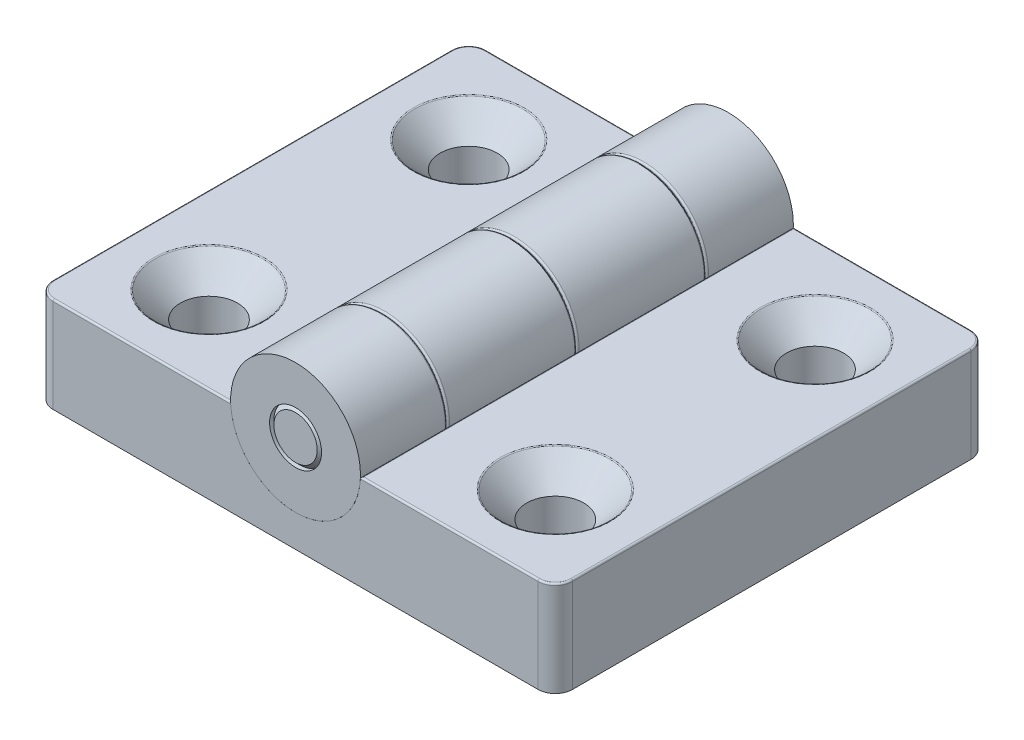
from build123d import *

# Parameters (mm, degrees)
SKETCH_1_R                  = 7.5
SKETCH_1_R_2                = 3
EXTRUDE_1_DEPTH             = 25
SKETCH_2_R                  = 3
EXTRUDE_2_DEPTH             = 25
CHAMFER_1_SIZE              = 0.5
SKETCH_3_W                  = 2
SKETCH_3_H                  = 0.1
SKETCH_3_W_2                = 2.605320606
FILLET_1_R                  = 0.2
EXTRUDE_6_DEPTH             = 50
HOLE_WIZARD_M6_1_AT_2_COUNT = 2
HOLE_WIZARD_M6_1_AT_2_PITCH = 40
HOLE_WIZARD_M6_1_AT_3_COUNT = 2
HOLE_WIZARD_M6_1_AT_3_PITCH = 30
HOLE_WIZARD_M6_1_AT_4_COUNT = 2
HOLE_WIZARD_M6_1_AT_4_PITCH = 50
FILLET_2_R                  = 0.2
FILLET_3_R                  = 2
CHAMFER_2_SIZE              = 0.5


with BuildPart() as part:
    # 草图1 → 凸台-拉伸1 (new, symmetric)
    with BuildSketch(Plane.XY):
        Circle(SKETCH_1_R)
        Circle(SKETCH_1_R_2, mode=Mode.SUBTRACT)
    extrude(amount=EXTRUDE_1_DEPTH, both=True)

    # 草图3 → 切除-旋转1 (revolve, cut)
    with BuildSketch(Plane(origin=(0, 0, 0), x_dir=(1, 0, 0), z_dir=(0, 1, 0))):
        with Locations((6.5, 14.95)):
            Rectangle(SKETCH_3_W, SKETCH_3_H)
        with Locations((6.5, 0)):
            Rectangle(SKETCH_3_W, SKETCH_3_H)
        with Locations((6.197339697, -14.95)):
            Rectangle(SKETCH_3_W_2, SKETCH_3_H)
    revolve(axis=Axis((0, 0, 25), (0, 0, -1)), mode=Mode.SUBTRACT)

    # 圆角1
    fillet_1_edges = [part.edges().sort_by_distance(p)[0] for p in [
        (-7.5, 0, -15),
        (-7.5, 0, -14.9),
        (-7.5, 0, -0.05),
        (-7.5, 0, 0.05),
        (-7.5, 0, 14.9),
        (-7.5, 0, 15),
    ]]
    fillet(fillet_1_edges, radius=FILLET_1_R)


with BuildPart() as body_2:
    # 草图2 → 凸台-拉伸2 (new, symmetric)
    with BuildSketch(Plane.XY):
        Circle(SKETCH_2_R)
    extrude(amount=EXTRUDE_2_DEPTH, both=True)

    # 倒角1
    chamfer_1_edges = [body_2.edges().sort_by_distance(p)[0] for p in [
        (-3, 0, 25),
    ]]
    chamfer(chamfer_1_edges, length=CHAMFER_1_SIZE)

    # 倒角2
    chamfer_2_edges = [body_2.edges().sort_by_distance(p)[0] for p in [
        (-3, 0, -25),
    ]]
    chamfer(chamfer_2_edges, length=CHAMFER_2_SIZE)


with BuildPart() as body_3:
    # 草图5 → 凸台-拉伸6 (new body)
    with BuildSketch(Plane(origin=(0, 0, -25), x_dir=(-1, 0, 0), z_dir=(0, 0, -1))):
        with BuildLine():
            Line((7.497332859, -0.2), (30, -0.2))
            Line((30, -0.2), (30, -11.2))
            Line((30, -11.2), (-30, -11.2))
            Line((-30, -11.2), (-30, -0.2))
            Line((-30, -0.2), (-7.497332859, -0.2))
            ThreePointArc((-7.497332859, -0.2), (0, -7.5), (7.497332859, -0.2))
        make_face()
    extrude(amount=-EXTRUDE_6_DEPTH)

    # 草图6 → M6 平头机械螺钉的锥形沉头孔1 (revolve, cut)
    with BuildSketch(Plane(origin=(-20, -0.2, -15), x_dir=(0, 0, 1), z_dir=(1, 0, 0))):
        Polygon((0, 0), (0, 11), (3.3, 11), (3.3, 3), (6.3, 0), align=None)
    hole_wizard_m6_1 = revolve(axis=Axis((-20, 6.15, -15), (0, -1, 0)), mode=Mode.SUBTRACT)

    # M6 平头机械螺钉的锥形沉头孔1 at 2: M6 平头机械螺钉的锥形沉头孔1 ×2
    with Locations(*[(i * HOLE_WIZARD_M6_1_AT_2_PITCH, 0, 0) for i in range(1, HOLE_WIZARD_M6_1_AT_2_COUNT)]):
        add(hole_wizard_m6_1, mode=Mode.SUBTRACT)

    # M6 平头机械螺钉的锥形沉头孔1 at 3: M6 平头机械螺钉的锥形沉头孔1 ×2
    with Locations(*[(0, 0, i * HOLE_WIZARD_M6_1_AT_3_PITCH) for i in range(1, HOLE_WIZARD_M6_1_AT_3_COUNT)]):
        add(hole_wizard_m6_1, mode=Mode.SUBTRACT)

    # M6 平头机械螺钉的锥形沉头孔1 at 4: M6 平头机械螺钉的锥形沉头孔1 ×2
    with Locations(*[Vector(0.8, 0, 0.6) * (i * HOLE_WIZARD_M6_1_AT_4_PITCH) for i in range(1, HOLE_WIZARD_M6_1_AT_4_COUNT)]):
        add(hole_wizard_m6_1, mode=Mode.SUBTRACT)

    # 圆角2
    fillet_2_edges = [body_3.edges().sort_by_distance(p)[0] for p in [
        (-18.74866643, -0.2, -25),
        (20, -0.2, 8.7),
        (18.74866643, -0.2, -25),
        (-20, -0.2, 8.7),
        (-30, -0.2, 0),
        (-18.74866643, -0.2, 25),
        (20, -0.2, -21.3),
        (-7.497332859, -0.2, 0),
        (7.497332859, -0.2, 0),
        (18.74866643, -0.2, 25),
        (30, -0.2, 0),
        (-20, -0.2, -21.3),
    ]]
    fillet(fillet_2_edges, radius=FILLET_2_R)

    # 圆角3
    # the kernel refuses this fillet: 2 mm, written as the material it takes off along each edge
    with BuildSketch(Plane(origin=(28, -0.2, 23), x_dir=(0, 0, 1), z_dir=(-1, 0, 0))) as fillet_3_piece_1:
        with BuildLine():
            CenterArc((1.8, -0.2), 0.2, 0, 90)
            Line((2, -0.2), (2, 0))
            Line((2, 0), (1.8, 0))
        make_face()
    revolve(axis=Axis((28, -0.2, 23), (0, 1, 0)), revolution_arc=90, mode=Mode.SUBTRACT)
    with BuildSketch(Plane(origin=(28, -0.2, -23), x_dir=(1, 0, 0), z_dir=(0, 0, 1))) as fillet_3_piece_2:
        with BuildLine():
            CenterArc((1.8, -0.2), 0.2, 0, 90)
            Line((2, -0.2), (2, 0))
            Line((2, 0), (1.8, 0))
        make_face()
    revolve(axis=Axis((28, -0.2, -23), (0, 1, 0)), revolution_arc=90, mode=Mode.SUBTRACT)
    with BuildSketch(Plane(origin=(-28, -0.2, 23), x_dir=(-1, 0, 0), z_dir=(0, 0, -1))) as fillet_3_piece_3:
        with BuildLine():
            CenterArc((1.8, -0.2), 0.2, 0, 90)
            Line((2, -0.2), (2, 0))
            Line((2, 0), (1.8, 0))
        make_face()
    revolve(axis=Axis((-28, -0.2, 23), (0, 1, 0)), revolution_arc=90, mode=Mode.SUBTRACT)
    with BuildSketch(Plane(origin=(-28, -0.2, -23), x_dir=(0, 0, -1), z_dir=(1, 0, 0))) as fillet_3_piece_4:
        with BuildLine():
            CenterArc((1.8, -0.2), 0.2, 0, 90)
            Line((2, -0.2), (2, 0))
            Line((2, 0), (1.8, 0))
        make_face()
    revolve(axis=Axis((-28, -0.2, -23), (0, 1, 0)), revolution_arc=90, mode=Mode.SUBTRACT)
    with BuildSketch(Plane(origin=(-30, -0.2, -25), x_dir=(1, 0, 0), z_dir=(0, -1, 0)), Plane(origin=(-30, -0.2, 25), x_dir=(0, 0, -1), z_dir=(0, -1, 0)), Plane(origin=(30, -16.2, -25), x_dir=(-1, 0, 0), z_dir=(0, 1, 0))) as fillet_3_piece_5:
        with BuildLine():
            CenterArc((FILLET_3_R, FILLET_3_R), FILLET_3_R, 180, 90)
            Line((0, FILLET_3_R), (0, 0))
            Line((0, 0), (FILLET_3_R, 0))
        make_face()
    extrude(amount=16, mode=Mode.SUBTRACT)
    with BuildSketch(Plane(origin=(30, -16.2, 25), x_dir=(-1, 0, 0), z_dir=(0, 1, 0))) as fillet_3_piece_6:
        with BuildLine():
            CenterArc((FILLET_3_R, -FILLET_3_R), FILLET_3_R, 90, 90)
            Line((0, -FILLET_3_R), (0, 0))
            Line((0, 0), (FILLET_3_R, 0))
        make_face()
    extrude(amount=16, mode=Mode.SUBTRACT)


solid = Compound([part.part, body_2.part, body_3.part])
